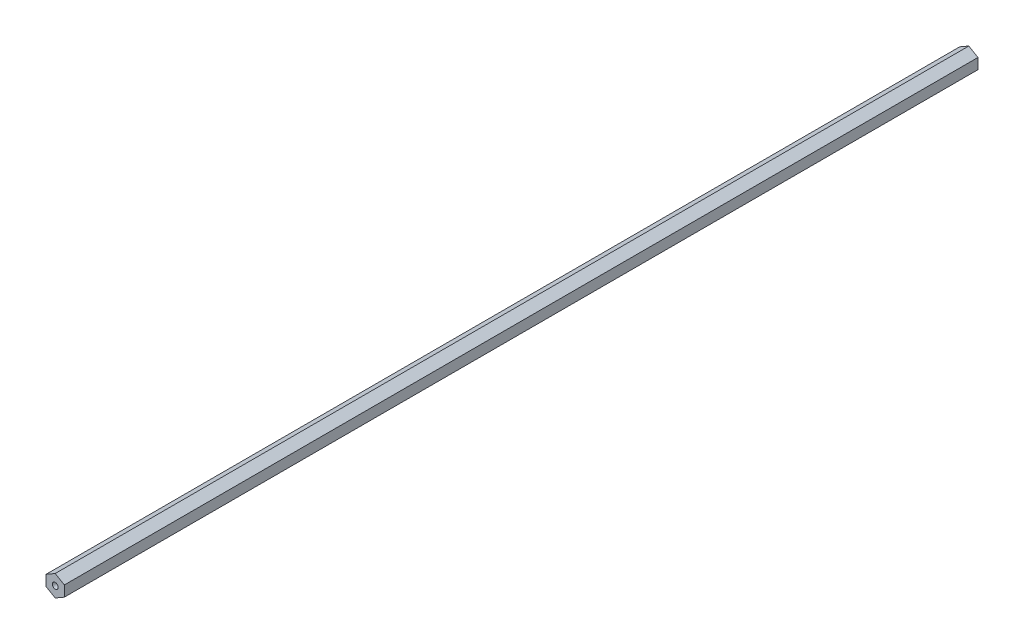
from build123d import *

# Parameters (mm, degrees)
BOSS_EXTRUDE1_DEPTH                  = 316.01149523
F_10_32_TAPPED_HOLE1_D               = 4.0386
F_10_32_TAPPED_HOLE1_DEPTH           = 16.34744
F_10_32_TAPPED_HOLE1_TIP             = 1.213317848
F_10_32_TAPPED_HOLE1_ON_FACE_2_D     = 4.0386
F_10_32_TAPPED_HOLE1_ON_FACE_2_DEPTH = 16.34744
F_10_32_TAPPED_HOLE1_ON_FACE_2_TIP   = 1.213317848


with BuildPart() as part:
    # Sketch1 → Boss-Extrude1 (new, symmetric)
    with BuildSketch(Plane.XY):
        Polygon((6.35, -3.666174209), (6.35, 3.666174209), (0, 7.332348419), (-6.35, 3.666174209), (-6.35, -3.666174209), (0, -7.332348419), align=None)
    extrude(amount=BOSS_EXTRUDE1_DEPTH, both=True)

    # #10-32 Tapped Hole1
    with Locations(Plane.XY.offset(316.01149523)):
        with Locations((0, 0)):
            Hole(F_10_32_TAPPED_HOLE1_D / 2, depth=F_10_32_TAPPED_HOLE1_DEPTH)
            with Locations((0, 0, -(F_10_32_TAPPED_HOLE1_DEPTH + F_10_32_TAPPED_HOLE1_TIP / 2))):  # 118° drill point
                Cone(0, F_10_32_TAPPED_HOLE1_D / 2, F_10_32_TAPPED_HOLE1_TIP, mode=Mode.SUBTRACT)

    # #10-32 Tapped Hole1 on face 2
    with Locations(Plane(origin=(0, 0, -316.01149523), x_dir=(-1, 0, 0), z_dir=(0, 0, -1))):
        with Locations((0, 0)):
            Hole(F_10_32_TAPPED_HOLE1_ON_FACE_2_D / 2, depth=F_10_32_TAPPED_HOLE1_ON_FACE_2_DEPTH)
            with Locations((0, 0, -(F_10_32_TAPPED_HOLE1_ON_FACE_2_DEPTH + F_10_32_TAPPED_HOLE1_ON_FACE_2_TIP / 2))):  # 118° drill point
                Cone(0, F_10_32_TAPPED_HOLE1_ON_FACE_2_D / 2, F_10_32_TAPPED_HOLE1_ON_FACE_2_TIP, mode=Mode.SUBTRACT)


solid = part.part
